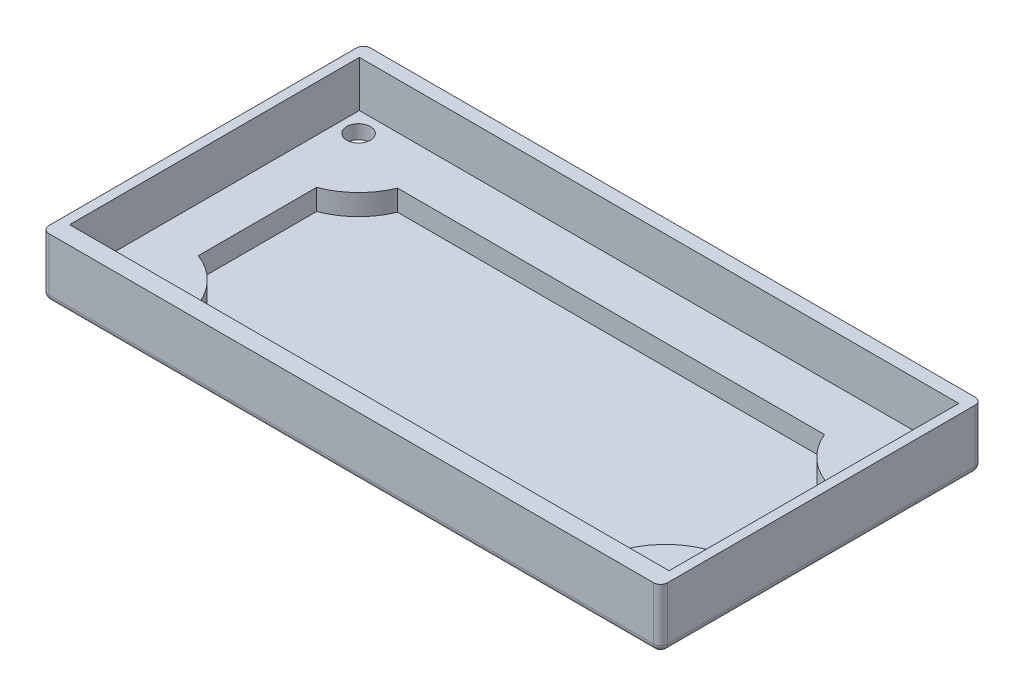
from build123d import *

# Parameters (mm, degrees)
TOP_COVER_SKETCH_01_W       = 44.37
TOP_COVER_SKETCH_01_H       = 23.06
TOP_COVER_EXT_SHAPE_DEPTH   = 4.3
SALIENTE_EXTRUIR1_DEPTH     = 1.5
VACIADO1_T                  = -1
VACIADO1_THICKNESS_2_FACE_W = 21.06
VACIADO1_THICKNESS_2_FACE_H = 3.3
VACIADO1_THICKNESS_2_DEPTH  = 0.31
VACIADO1_THICKNESS_3_FACE_W = 21.06
VACIADO1_THICKNESS_3_FACE_H = 3.3
VACIADO1_THICKNESS_3_DEPTH  = 0.31
VACIADO1_THICKNESS_4_FACE_W = 42.99
VACIADO1_THICKNESS_4_FACE_H = 3.3
VACIADO1_THICKNESS_4_DEPTH  = 0.02
VACIADO1_THICKNESS_5_FACE_W = 42.99
VACIADO1_THICKNESS_5_FACE_H = 3.3
VACIADO1_THICKNESS_5_DEPTH  = 0.3
CROQUIS1_R                  = 3.25
CORTAR_EXTRUIR1_DEPTH       = 0.7
CROQUIS1_5_R                = 5
CROQUIS1_5_R_2              = 3.25
CORTAR_EXTRUIR2_DEPTH       = 0.5
CROQUIS2_R                  = 3
SALIENTE_EXTRUIR2_DEPTH     = 3.7
REDONDEO1_R                 = 0.5
REDONDEO2_R                 = 0.3
TOP_COVER_SKETCH_01_19_R    = 0.85
CORTAR_EXTRUIR3_DEPTH       = 1


with BuildPart() as part:
    # Top-cover-sketch-01 → Top-cover-ext-shape (new body)
    with BuildSketch(Plane(origin=(0, 0, 0), x_dir=(1, 0, 0), z_dir=(0, 1, 0))):
        Rectangle(TOP_COVER_SKETCH_01_W, TOP_COVER_SKETCH_01_H)
    extrude(amount=TOP_COVER_EXT_SHAPE_DEPTH)

    # Top-cover-sketch-01<18> → Saliente-Extruir1 (add)
    with BuildSketch(Plane(origin=(0, 0, 0), x_dir=(1, 0, 0), z_dir=(0, 1, 0))):
        with BuildLine():
            Line((-19.255, -4.986911136), (-19.255, 4.986911136))
            ThreePointArc((-19.255, 4.986911136), (-17.190017633, 6.076280801), (-16.025784389, 8.1))
            Line((-16.025784389, 8.1), (16.025784389, 8.1))
            ThreePointArc((16.025784389, 8.1), (17.190017633, 6.076280801), (19.255, 4.986911136))
            Line((19.255, 4.986911136), (19.255, -4.986911136))
            ThreePointArc((19.255, -4.986911136), (17.190017633, -6.076280801), (16.025784389, -8.1))
            Line((16.025784389, -8.1), (-16.025784389, -8.1))
            ThreePointArc((-16.025784389, -8.1), (-17.190017633, -6.076280801), (-19.255, -4.986911136))
        make_face()
    extrude(amount=-SALIENTE_EXTRUIR1_DEPTH)

    # Vaciado1
    vaciado1_openings = [part.faces().sort_by_distance(p)[0] for p in [
        (0, 4.3, 0),
    ]]
    offset(amount=VACIADO1_T, openings=vaciado1_openings, kind=Kind.INTERSECTION)

    # Vaciado1 thickness 2 face (on inner face of the shell) → Vaciado1 thickness 2 (cut)
    with BuildSketch(Plane(origin=(-21.185, 2.65, 0), x_dir=(0, 0, -1), z_dir=(-1, 0, 0))):
        Rectangle(VACIADO1_THICKNESS_2_FACE_W, VACIADO1_THICKNESS_2_FACE_H)
    extrude(amount=VACIADO1_THICKNESS_2_DEPTH, mode=Mode.SUBTRACT)

    # Vaciado1 thickness 3 face (on inner face of the shell) → Vaciado1 thickness 3 (cut)
    with BuildSketch(Plane(origin=(21.185, 2.65, 0), x_dir=(0, 0, 1), z_dir=(1, 0, 0))):
        Rectangle(VACIADO1_THICKNESS_3_FACE_W, VACIADO1_THICKNESS_3_FACE_H)
    extrude(amount=VACIADO1_THICKNESS_3_DEPTH, mode=Mode.SUBTRACT)

    # Vaciado1 thickness 4 face (on inner face of the shell) → Vaciado1 thickness 4 (cut)
    with BuildSketch(Plane(origin=(0, 2.65, -10.53), x_dir=(-1, 0, 0), z_dir=(0, 0, -1))):
        Rectangle(VACIADO1_THICKNESS_4_FACE_W, VACIADO1_THICKNESS_4_FACE_H)
    extrude(amount=VACIADO1_THICKNESS_4_DEPTH, mode=Mode.SUBTRACT)

    # Vaciado1 thickness 5 face (on inner face of the shell) → Vaciado1 thickness 5 (add)
    with BuildSketch(Plane(origin=(0, 2.65, 10.53), x_dir=(1, 0, 0), z_dir=(0, 0, 1))):
        Rectangle(VACIADO1_THICKNESS_5_FACE_W, VACIADO1_THICKNESS_5_FACE_H)
    extrude(amount=-VACIADO1_THICKNESS_5_DEPTH)

    # Croquis1 → Cortar-Extruir1 (cut)
    with BuildSketch(Plane.XZ.offset(1.5)):
        with Locations(Location((-11.878900962, 0, 0), (0, 0, 270))):
            Circle(CROQUIS1_R)
    extrude(amount=-CORTAR_EXTRUIR1_DEPTH, mode=Mode.SUBTRACT)

    # Croquis1<5> → Cortar-Extruir2 (cut)
    with BuildSketch(Plane.XZ.offset(1.5)):
        with Locations(Location((-11.878900962, 0, 0), (0, 0, 270))):
            Circle(CROQUIS1_5_R)
        with Locations(Location((-11.878900962, 0, 0), (0, 0, 270))):
            Circle(CROQUIS1_5_R_2, mode=Mode.SUBTRACT)
    extrude(amount=-CORTAR_EXTRUIR2_DEPTH, mode=Mode.SUBTRACT)

    # Croquis2 → Saliente-Extruir2 (add)
    with BuildSketch(Plane.XZ.offset(0.8)):
        with Locations(Location((-11.878900962, 0, 0), (0, 0, 270))):
            Circle(CROQUIS2_R)
    extrude(amount=SALIENTE_EXTRUIR2_DEPTH)

    # Redondeo1
    redondeo1_edges = [part.edges().sort_by_distance(p)[0] for p in [
        (0, 0, -11.53),
        (22.185, 0, 0),
        (0, 0, 11.53),
        (-22.185, 0, 0),
        (-22.185, 2.15, -11.53),
        (22.185, 2.15, -11.53),
        (22.185, 2.15, 11.53),
        (-22.185, 2.15, 11.53),
    ]]
    fillet(redondeo1_edges, radius=REDONDEO1_R)

    # Redondeo2
    redondeo2_edges = [part.edges().sort_by_distance(p)[0] for p in [
        (-19.255, -0.75, 4.986911136),
        (-19.255, -0.75, -4.986911136),
        (-16.025784389, -0.75, -8.1),
        (16.025784389, -0.75, -8.1),
        (19.255, -0.75, -4.986911136),
        (19.255, -0.75, 4.986911136),
        (0, -1.5, 8.1),
        (16.025784389, -0.75, 8.1),
        (-17.190017633, -1.5, 6.076280801),
        (-16.025784389, -0.75, 8.1),
        (-19.255, -1.5, 0),
        (-17.190017633, -1.5, -6.076280801),
        (0, -1.5, -8.1),
        (17.190017633, -1.5, -6.076280801),
        (19.255, -1.5, 0),
        (17.190017633, -1.5, 6.076280801),
        (-11.878900962, -1.5, 5),
    ]]
    fillet(redondeo2_edges, radius=REDONDEO2_R)

    # Chaflán1: read off the stored shape, not the designer's step
    # Chaflán1 outline → Chaflán1 (revolve, cut)
    with BuildSketch(Plane(origin=(-11.878900962, 0, 0), x_dir=(1, 0, 0), z_dir=(0, 0, 1))):
        Polygon((3, -4.2), (2.7, -4.5), (3, -4.5), align=None)
    revolve(axis=Axis((-11.878900962, 0, 0), (0, 1, 0)), mode=Mode.SUBTRACT)

    # Top-cover-sketch-01<19> → Cortar-Extruir3 (cut)
    with BuildSketch(Plane(origin=(0, 0, 0), x_dir=(1, 0, 0), z_dir=(0, 1, 0))):
        with Locations(Location((-20.105, 9.1, 0), (0, 0, 270))):
            Circle(TOP_COVER_SKETCH_01_19_R)
        with Locations(Location((20.105, 9.1, 0), (0, 0, 270))):
            Circle(TOP_COVER_SKETCH_01_19_R)
        with Locations(Location((20.105, -9.1, 0), (0, 0, 270))):
            Circle(TOP_COVER_SKETCH_01_19_R)
        with Locations(Location((-20.105, -9.1, 0), (0, 0, 270))):
            Circle(TOP_COVER_SKETCH_01_19_R)
    extrude(amount=CORTAR_EXTRUIR3_DEPTH, mode=Mode.SUBTRACT)


solid = part.part
